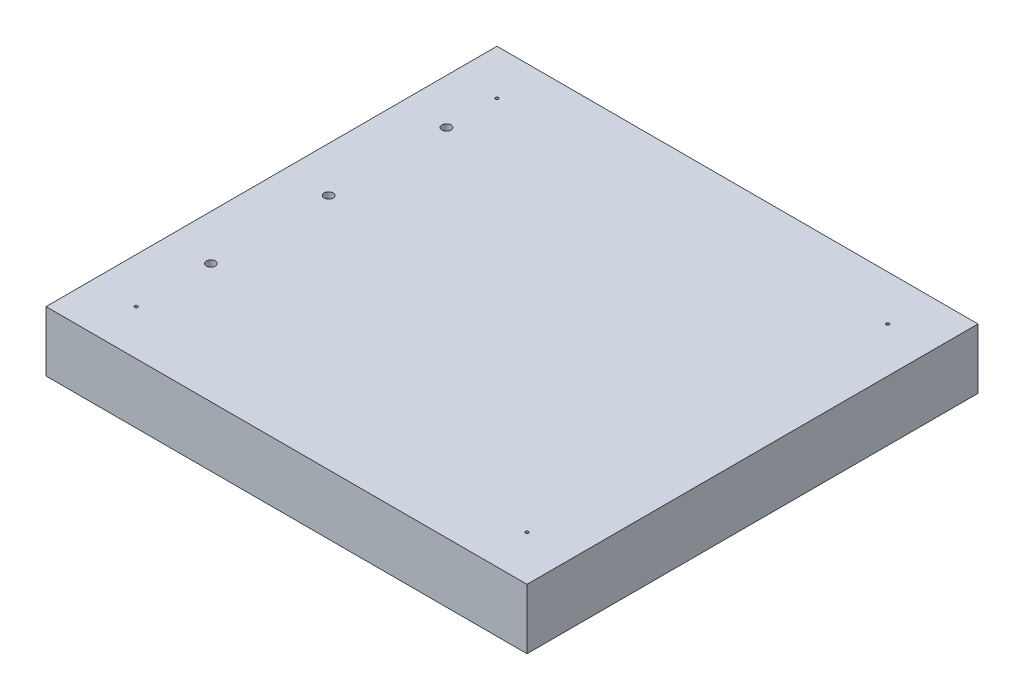
from build123d import *

# Parameters (mm, degrees)
SKETCH2_W           = 160
SKETCH2_H           = 150
BOSS_EXTRUDE1_DEPTH = 20
SKETCH3_R           = 1.5
CUT_EXTRUDE1_DEPTH  = 112.467484048
SKETCH4_R           = 1.5
CUT_EXTRUDE2_DEPTH  = 112.467484048
CUT_EXTRUDE3_REACH  = 113.467
SKETCH6_R           = 1.5
CUT_EXTRUDE4_REACH  = 113.467
SKETCH7_R           = 0.5
CUT_EXTRUDE5_REACH  = 113.467
SKETCH8_R           = 0.5
CUT_EXTRUDE6_REACH  = 113.467
SKETCH9_R           = 0.5
CUT_EXTRUDE7_REACH  = 113.467
SKETCH10_R          = 0.5


with BuildPart() as part:
    # Sketch2 → Boss-Extrude1 (new body)
    with BuildSketch(Plane(origin=(0, 0, 0), x_dir=(1, 0, 0), z_dir=(0, 1, 0))):
        Rectangle(SKETCH2_W, SKETCH2_H)
    extrude(amount=BOSS_EXTRUDE1_DEPTH)

    # Sketch3 → Cut-Extrude1 (cut, through all)
    with BuildSketch(Plane(origin=(0, 20, 0), x_dir=(-1, 0, 0), z_dir=(0, 1, 0))):
        with Locations((65, -43.201)):
            Circle(SKETCH3_R)
    extrude(amount=-CUT_EXTRUDE1_DEPTH, mode=Mode.SUBTRACT)

    # Sketch4 → Cut-Extrude2 (cut, through all)
    with BuildSketch(Plane(origin=(0, 20, 0), x_dir=(1, 0, 0), z_dir=(0, 1, 0))):
        with Locations((-65, -35.161)):
            Circle(SKETCH4_R)
    extrude(amount=-CUT_EXTRUDE2_DEPTH, mode=Mode.SUBTRACT)

    # Sketch6 → Cut-Extrude3 (cut, up to next)
    with BuildSketch(Plane(origin=(0, 20, 0), x_dir=(-1, 0, 0), z_dir=(0, 1, 0)), mode=Mode.PRIVATE) as cut_extrude3_sk1:
        with Locations((65, -4.02)):
            Circle(SKETCH6_R)
    cut_extrude3_tool1 = extrude(cut_extrude3_sk1.sketch, amount=-CUT_EXTRUDE3_REACH, mode=Mode.PRIVATE) & part.part
    add(cut_extrude3_tool1.solids().sort_by_distance((-65, 20, -4.02))[0], mode=Mode.SUBTRACT)

    # Sketch7 → Cut-Extrude4 (cut, up to next)
    with BuildSketch(Plane(origin=(0, 20, 0), x_dir=(-1, 0, 0), z_dir=(0, 1, 0)), mode=Mode.PRIVATE) as cut_extrude4_sk1:
        with Locations((65, -60)):
            Circle(SKETCH7_R)
    cut_extrude4_tool1 = extrude(cut_extrude4_sk1.sketch, amount=-CUT_EXTRUDE4_REACH, mode=Mode.PRIVATE) & part.part
    add(cut_extrude4_tool1.solids().sort_by_distance((-65, 20, -60))[0], mode=Mode.SUBTRACT)

    # Sketch8 → Cut-Extrude5 (cut, up to next)
    with BuildSketch(Plane(origin=(0, 20, 0), x_dir=(-1, 0, 0), z_dir=(0, 1, 0)), mode=Mode.PRIVATE) as cut_extrude5_sk1:
        with Locations((-65, -60)):
            Circle(SKETCH8_R)
    cut_extrude5_tool1 = extrude(cut_extrude5_sk1.sketch, amount=-CUT_EXTRUDE5_REACH, mode=Mode.PRIVATE) & part.part
    add(cut_extrude5_tool1.solids().sort_by_distance((65, 20, -60))[0], mode=Mode.SUBTRACT)

    # Sketch9 → Cut-Extrude6 (cut, up to next)
    with BuildSketch(Plane(origin=(0, 20, 0), x_dir=(-1, 0, 0), z_dir=(0, 1, 0)), mode=Mode.PRIVATE) as cut_extrude6_sk1:
        with Locations((65, 60)):
            Circle(SKETCH9_R)
    cut_extrude6_tool1 = extrude(cut_extrude6_sk1.sketch, amount=-CUT_EXTRUDE6_REACH, mode=Mode.PRIVATE) & part.part
    add(cut_extrude6_tool1.solids().sort_by_distance((-65, 20, 60))[0], mode=Mode.SUBTRACT)

    # Sketch10 → Cut-Extrude7 (cut, up to next)
    with BuildSketch(Plane(origin=(0, 20, 0), x_dir=(-1, 0, 0), z_dir=(0, 1, 0)), mode=Mode.PRIVATE) as cut_extrude7_sk1:
        with Locations((-65, 60)):
            Circle(SKETCH10_R)
    cut_extrude7_tool1 = extrude(cut_extrude7_sk1.sketch, amount=-CUT_EXTRUDE7_REACH, mode=Mode.PRIVATE) & part.part
    add(cut_extrude7_tool1.solids().sort_by_distance((65, 20, 60))[0], mode=Mode.SUBTRACT)


solid = part.part
